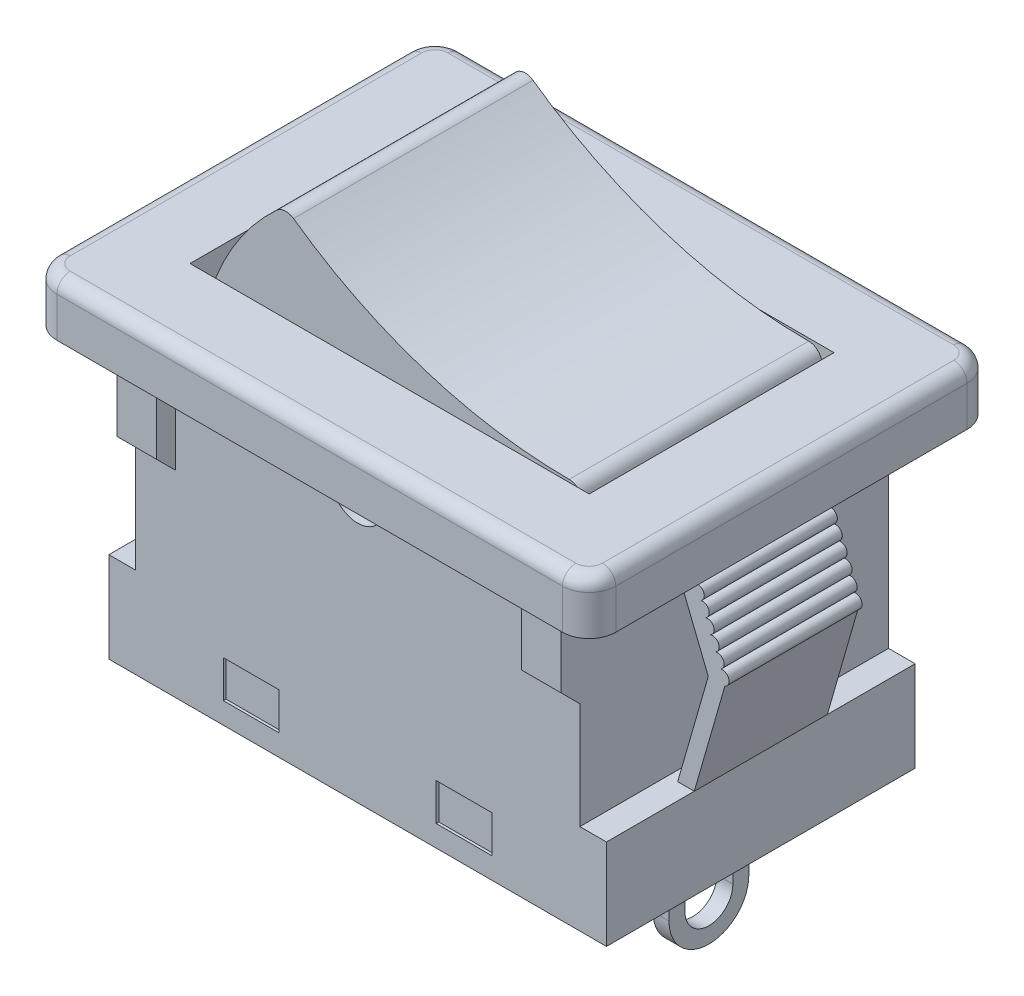
from build123d import *
from OCP.BRepFilletAPI import BRepFilletAPI_MakeChamfer

# Parameters (mm, degrees)
SKETCH1_W               = 15
SKETCH1_H               = 9.2
BOSS_EXTRUDE1_DEPTH     = 2
FILLET1_R               = 0.5
SKETCH2_R               = 1
SKETCH2_W               = 2.1
SKETCH2_H               = 1.4
BOSS_EXTRUDE4_DEPTH     = 5.8
SHELL1_START            = -11.2
SHELL1_OUTLINE_W        = 14.3
SHELL1_OUTLINE_H        = 9.2
SHELL1_DEPTH            = 11.2
SHELL1_2_OUTLINE_W      = 1
SHELL1_2_OUTLINE_H      = 9.2
SHELL1_2_DEPTH          = 2.2
BOSS_EXTRUDE5_DEPTH     = 1.4
CHAMFER1_SIZE           = 0.291176187
CHAMFER1_SIZE_2         = 0.8
BOSS_EXTRUDE6_DEPTH     = 0.3
BOSS_EXTRUDE7_START     = 7.4
BOSS_EXTRUDE7_DEPTH     = 0.6
BOSS_EXTRUDE8_DEPTH     = 4.5
SKETCH6_R               = 0.95
BOSS_EXTRUDE9_DEPTH     = 5
CUT_EXTRUDE2_REACH      = 27.963
CUT_EXTRUDE2_END_RADIUS = 9
CUT_EXTRUDE2_START      = 0.1
BOSS_EXTRUDE10_START    = 8.35
BOSS_EXTRUDE10_DEPTH    = 1.5
BOSS_EXTRUDE11_START    = -8.35
BOSS_EXTRUDE11_DEPTH    = 1.5
BOSS_EXTRUDE12_DEPTH    = 2.5


# Read off the part's stored shape, not the designer's step: Shell1
with BuildPart() as part:
    # Sketch1 → Boss-Extrude1 (new body)
    with BuildSketch(Plane(origin=(0, 0, 0), x_dir=(1, 0, 0), z_dir=(0, 1, 0))):
        with BuildLine():
            Line((9.5, -7.6), (-9.5, -7.6))
            ThreePointArc((-9.5, -7.6), (-10.207106781, -7.307106781), (-10.5, -6.6))
            Line((-10.5, -6.6), (-10.5, 6.6))
            ThreePointArc((-10.5, 6.6), (-10.207106781, 7.307106781), (-9.5, 7.6))
            Line((-9.5, 7.6), (9.5, 7.6))
            ThreePointArc((9.5, 7.6), (10.207106781, 7.307106781), (10.5, 6.6))
            Line((10.5, 6.6), (10.5, -6.6))
            ThreePointArc((10.5, -6.6), (10.207106781, -7.307106781), (9.5, -7.6))
        make_face()
        Rectangle(SKETCH1_W, SKETCH1_H, mode=Mode.SUBTRACT)
    extrude(amount=BOSS_EXTRUDE1_DEPTH)

    # Fillet1
    fillet1_edges = [part.edges().sort_by_distance(p)[0] for p in [
        (-10.207106781, 2, -7.307106781),
        (-10.5, 2, 0),
        (-10.207106781, 2, 7.307106781),
        (0, 2, 7.6),
        (10.207106781, 2, 7.307106781),
        (10.5, 2, 0),
        (10.207106781, 2, -7.307106781),
        (0, 2, -7.6),
    ]]
    fillet(fillet1_edges, radius=FILLET1_R)

    # Sketch2 → Boss-Extrude4 (add, symmetric)
    with BuildSketch(Plane.XY):
        Polygon((-8.35, 0), (8.35, 0), (8.35, -7.8), (9.35, -7.8), (9.35, -11.2), (-9.35, -11.2), (-9.35, -7.8), (-8.35, -7.8), align=None)
        with Locations((0, -1.1)):
            Circle(SKETCH2_R, mode=Mode.SUBTRACT)
        with Locations((-4, -9.7)):
            Rectangle(SKETCH2_W, SKETCH2_H, mode=Mode.SUBTRACT)
        with Locations((4, -9.7)):
            Rectangle(SKETCH2_W, SKETCH2_H, mode=Mode.SUBTRACT)
    extrude(amount=BOSS_EXTRUDE4_DEPTH, both=True)

    # Shell1 outline → Shell1 (cut)
    with BuildSketch(Plane(origin=(0, 0, 0), x_dir=(1, 0, 0), z_dir=(0, 1, 0)).offset(SHELL1_START)):
        Rectangle(SHELL1_OUTLINE_W, SHELL1_OUTLINE_H)
    extrude(amount=SHELL1_DEPTH, mode=Mode.SUBTRACT)

    # Shell1 2 outline → Shell1 2 (cut)
    with BuildSketch(Plane(origin=(0, 0, 0), x_dir=(1, 0, 0), z_dir=(0, 1, 0)).offset(SHELL1_START)):
        with Locations((7.65, 0)):
            Rectangle(SHELL1_2_OUTLINE_W, SHELL1_2_OUTLINE_H)
        with Locations((-7.65, 0)):
            Rectangle(SHELL1_2_OUTLINE_W, SHELL1_2_OUTLINE_H)
    extrude(amount=SHELL1_2_DEPTH, mode=Mode.SUBTRACT)

    # Sketch3 → Boss-Extrude5 (add)
    with BuildSketch(Plane.XZ.offset(9)):
        Polygon((-5.05, -4.6), (-8.15, -4.6), (-8.15, 4.6), (-5.05, 4.6), (-5.05, 5.7), (-2.95, 5.7), (-2.95, 4.6), (2.95, 4.6), (2.95, 5.7), (5.05, 5.7), (5.05, 4.6), (8.15, 4.6), (8.15, -4.6), (5.05, -4.6), (5.05, -5.7), (2.95, -5.7), (2.95, -4.6), (-2.95, -4.6), (-2.95, -5.7), (-5.05, -5.7), align=None)
    extrude(amount=BOSS_EXTRUDE5_DEPTH)

    # Chamfer1
    chamfer1_edges_1 = [part.edges().sort_by_distance(p)[0] for p in [
        (0, -10.4, -4.6),
    ]]
    chamfer1_side_1 = [part.faces().sort_by_distance(p)[0] for p in [
        (0, -10.4, -4.594176476),
    ]]
    chamfer1_edges_2 = [part.edges().sort_by_distance(p)[0] for p in [
        (0, -10.4, 4.6),
    ]]
    chamfer1_side_2 = [part.faces().sort_by_distance(p)[0] for p in [
        (0, -10.4, 4.594176476),
    ]]
    chamfer1 = BRepFilletAPI_MakeChamfer(part.part.solid().wrapped)
    for e in chamfer1_edges_1:
        chamfer1.Add(CHAMFER1_SIZE - 0.0001, CHAMFER1_SIZE_2 - 0.0001, e.wrapped, chamfer1_side_1[0].wrapped)
    for e in chamfer1_edges_2:
        chamfer1.Add(CHAMFER1_SIZE - 0.0001, CHAMFER1_SIZE_2 - 0.0001, e.wrapped, chamfer1_side_2[0].wrapped)
    add(Compound.cast(chamfer1.Shape()), mode=Mode.REPLACE)  # a hair under: the kernel refuses the full size

    # Sketch4 → Boss-Extrude6 (add, symmetric)
    with BuildSketch(Plane(origin=(0, 0, 0), x_dir=(0, 0, -1), z_dir=(1, 0, 0))):
        with BuildLine():
            Line((-1.5, -10.4), (1.5, -10.4))
            Line((1.5, -10.4), (1.5, -13.5))
            ThreePointArc((1.5, -13.5), (0, -15), (-1.5, -13.5))
            Line((-1.5, -13.5), (-1.5, -10.4))
        make_face()
        with BuildLine():
            Line((0.9, -12.8), (0.9, -13.5))
            ThreePointArc((0.9, -13.5), (0, -14.4), (-0.9, -13.5))
            Line((-0.9, -13.5), (-0.9, -12.8))
            ThreePointArc((-0.9, -12.8), (0, -11.9), (0.9, -12.8))
        make_face(mode=Mode.SUBTRACT)
    extrude(amount=BOSS_EXTRUDE6_DEPTH, both=True)

    # Sketch4<2> → Boss-Extrude7 (add)
    with BuildSketch(Plane(origin=(0, 0, 0), x_dir=(0, 0, -1), z_dir=(1, 0, 0)).offset(BOSS_EXTRUDE7_START)):
        with BuildLine():
            Line((-1.5, -10.4), (1.5, -10.4))
            Line((1.5, -10.4), (1.5, -13.5))
            ThreePointArc((1.5, -13.5), (0, -15), (-1.5, -13.5))
            Line((-1.5, -13.5), (-1.5, -10.4))
        make_face()
        with BuildLine():
            Line((0.9, -12.8), (0.9, -13.5))
            ThreePointArc((0.9, -13.5), (0, -14.4), (-0.9, -13.5))
            Line((-0.9, -13.5), (-0.9, -12.8))
            ThreePointArc((-0.9, -12.8), (0, -11.9), (0.9, -12.8))
        make_face(mode=Mode.SUBTRACT)
    extrude(amount=-BOSS_EXTRUDE7_DEPTH)

    # Sketch9 → Boss-Extrude10 (add)
    with BuildSketch(Plane(origin=(0, 0, 0), x_dir=(0, 0, -1), z_dir=(1, 0, 0)).offset(BOSS_EXTRUDE10_START)):
        Polygon((-5.8, 0), (-6.5, 0), (-6.5, -3.1), (-5.8, -3.8), align=None)
        Polygon((5.8, 0), (6.5, 0), (6.5, -1.3), (5.8, -2), align=None)
    extrude(amount=-BOSS_EXTRUDE10_DEPTH)

    # Sketch9<2> → Boss-Extrude11 (add)
    with BuildSketch(Plane(origin=(0, 0, 0), x_dir=(0, 0, -1), z_dir=(1, 0, 0)).offset(BOSS_EXTRUDE11_START)):
        Polygon((-5.8, 0), (-6.5, 0), (-6.5, -3.1), (-5.8, -3.8), align=None)
        Polygon((5.8, 0), (6.5, 0), (6.5, -1.3), (5.8, -2), align=None)
    extrude(amount=BOSS_EXTRUDE11_DEPTH)

    # Sketch10 → Boss-Extrude12 (add, symmetric)
    with BuildSketch(Plane.XY):
        with BuildLine():
            Line((-9.35, -7.8), (-10.5, -3.8))
            ThreePointArc((-10.5, -3.8), (-10.638851729, -3.474853576), (-10.313705305, -3.336001846))
            ThreePointArc((-10.313705305, -3.336001846), (-10.452557034, -3.010855422), (-10.127410609, -2.872003693))
            ThreePointArc((-10.127410609, -2.872003693), (-10.266262338, -2.546857268), (-9.941115914, -2.408005539))
            ThreePointArc((-9.941115914, -2.408005539), (-10.079967643, -2.082859115), (-9.754821219, -1.944007386))
            ThreePointArc((-9.754821219, -1.944007386), (-9.893672948, -1.618860961), (-9.568526523, -1.480009232))
            ThreePointArc((-9.568526523, -1.480009232), (-9.707378252, -1.154862808), (-9.382231828, -1.016011079))
            ThreePointArc((-9.382231828, -1.016011079), (-9.521083557, -0.690864654), (-9.195937133, -0.552012925))
            ThreePointArc((-9.195937133, -0.552012925), (-9.334788862, -0.226866501), (-9.009642437, -0.088014772))
            Line((-9.009642437, -0.088014772), (-8.974304613, 0))
            Line((-8.974304613, 0), (-8.35, 0))
            Line((-8.35, 0), (-9.875695387, -3.8))
            Line((-9.875695387, -3.8), (-8.725695387, -7.8))
            Line((-8.725695387, -7.8), (-9.35, -7.8))
        make_face()
        with BuildLine():
            Line((9.35, -7.8), (8.725695387, -7.8))
            Line((8.725695387, -7.8), (9.875695387, -3.8))
            Line((9.875695387, -3.8), (8.35, 0))
            Line((8.35, 0), (8.974304613, 0))
            Line((8.974304613, 0), (9.009642437, -0.088014772))
            ThreePointArc((9.009642437, -0.088014772), (9.334788862, -0.226866501), (9.195937133, -0.552012925))
            ThreePointArc((9.195937133, -0.552012925), (9.521083557, -0.690864654), (9.382231828, -1.016011079))
            ThreePointArc((9.382231828, -1.016011079), (9.707378252, -1.154862808), (9.568526523, -1.480009232))
            ThreePointArc((9.568526523, -1.480009232), (9.893672948, -1.618860961), (9.754821219, -1.944007386))
            ThreePointArc((9.754821219, -1.944007386), (10.079967643, -2.082859115), (9.941115914, -2.408005539))
            ThreePointArc((9.941115914, -2.408005539), (10.266262338, -2.546857268), (10.127410609, -2.872003693))
            ThreePointArc((10.127410609, -2.872003693), (10.452557034, -3.010855422), (10.313705305, -3.336001846))
            ThreePointArc((10.313705305, -3.336001846), (10.638851729, -3.474853576), (10.5, -3.8))
            Line((10.5, -3.8), (9.35, -7.8))
        make_face()
    extrude(amount=BOSS_EXTRUDE12_DEPTH, both=True)


with BuildPart() as body_2:
    # Sketch5 → Boss-Extrude8 (new, symmetric)
    with BuildSketch(Plane.XY):
        with BuildLine():
            Line((7.15, 1.5), (7.15, -2.1))
            Line((7.15, -2.1), (-7.15, -2.1))
            Line((-7.15, -2.1), (-7.15, 0))
            ThreePointArc((-7.15, 0), (-6.193721683, 2.874256564), (-4.338006175, 5.268445146))
            ThreePointArc((-4.338006175, 5.268445146), (-4.031053715, 5.399034735), (-3.710279439, 5.307507051))
            ThreePointArc((-3.710279439, 5.307507051), (1.212284649, 2.846935739), (6.65, 2))
            ThreePointArc((6.65, 2), (7.003553391, 1.853553391), (7.15, 1.5))
        make_face()
    extrude(amount=BOSS_EXTRUDE8_DEPTH, both=True)

    # Cut-Extrude2: up to this cylinder (the profile starts inside it)
    cut_extrude2_end = Plane(origin=(1.746104975, -1.363567484, 0), z_dir=(0, 0, -1)) * Cylinder(CUT_EXTRUDE2_END_RADIUS, 74.926, mode=Mode.PRIVATE)
    # Sketch7 → Cut-Extrude2 (cut, up to the surface)
    with BuildSketch(Plane(origin=(-5.285133561, 4.024702284, 0), x_dir=(0, 0, 1), z_dir=(-0.7955816281970499, 0.6058464103015969, 0)).offset(CUT_EXTRUDE2_START), mode=Mode.PRIVATE) as cut_extrude2_sk1:
        with BuildLine():
            Line((1.55, -0.436687302), (-1.55, -0.436687302))
            ThreePointArc((-1.55, -0.436687302), (-1.620710678, -0.40739798), (-1.65, -0.336687302))
            Line((-1.65, -0.336687302), (-1.65, 0.463312698))
            ThreePointArc((-1.65, 0.463312698), (-1.620710678, 0.534023377), (-1.55, 0.563312698))
            Line((-1.55, 0.563312698), (1.55, 0.563312698))
            ThreePointArc((1.55, 0.563312698), (1.620710678, 0.534023377), (1.65, 0.463312698))
            Line((1.65, 0.463312698), (1.65, -0.336687302))
            ThreePointArc((1.65, -0.336687302), (1.620710678, -0.40739798), (1.55, -0.436687302))
        make_face()
    cut_extrude2_tool1 = extrude(cut_extrude2_sk1.sketch, amount=CUT_EXTRUDE2_REACH, mode=Mode.PRIVATE) & cut_extrude2_end
    add(cut_extrude2_tool1.solids().sort_by_distance((-5.326334, 4.135657, 0))[0], mode=Mode.SUBTRACT)


with BuildPart() as body_3:
    # Sketch6 → Boss-Extrude9 (new, symmetric)
    with BuildSketch(Plane.XY):
        with Locations((0, -1.1)):
            Circle(SKETCH6_R)
    extrude(amount=BOSS_EXTRUDE9_DEPTH, both=True)


solid = Compound([part.part, body_2.part, body_3.part])
